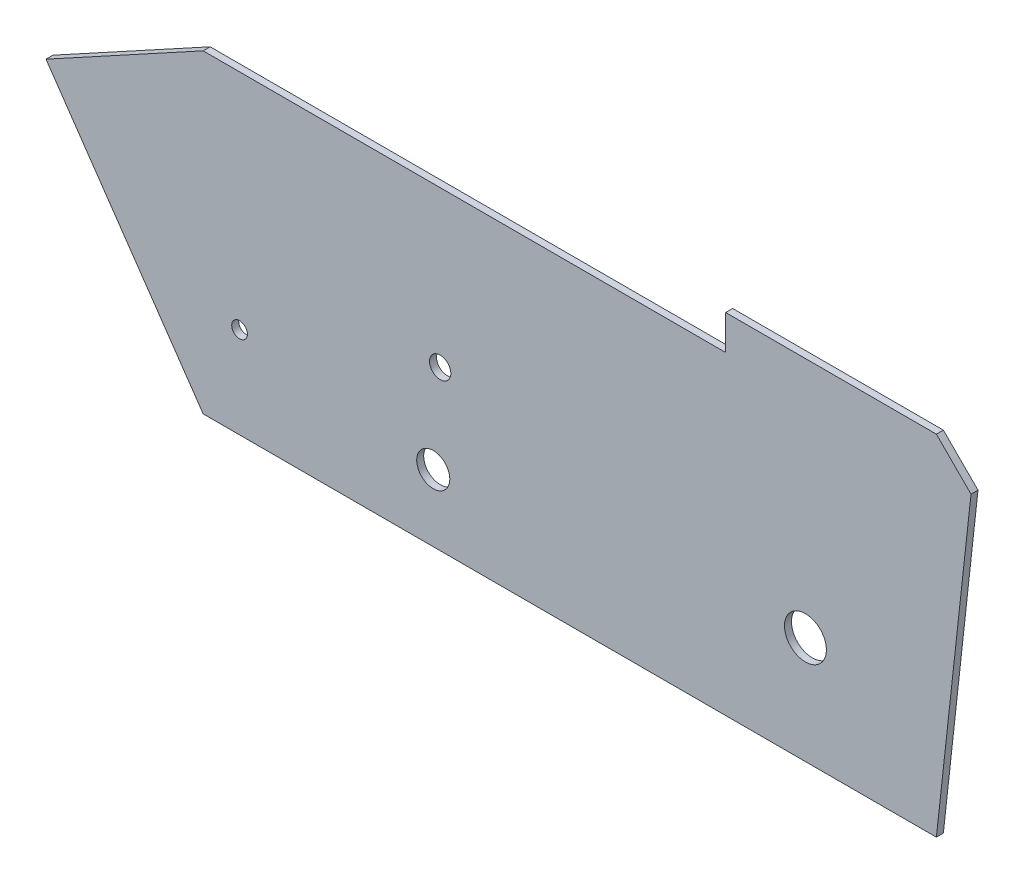
from build123d import *

# Parameters (mm, degrees)
BOSS_EXTRUDE1_DEPTH = 2
SKETCH2_R           = 6
CUT_EXTRUDE1_DEPTH  = 10
SKETCH3_R           = 3.05
CUT_EXTRUDE2_DEPTH  = 10
SKETCH4_R           = 2.250300441
CUT_EXTRUDE3_DEPTH  = 10
SKETCH5_R           = 4.740417633
CUT_EXTRUDE4_DEPTH  = 10


with BuildPart() as part:
    # Sketch1 → Boss-Extrude1 (new body)
    with BuildSketch(Plane.XY):
        Polygon((192.039285274, 88.983833718), (201.963048499, 79.060070494), (192.039285274, -11.016166282), (-18.008037477, -11.016166282), (-63.036951501, 54.472600305), (-18.008037477, 79.060070494), (131.67120814, 79.060070494), (131.67120814, 88.983833718), align=None)
    extrude(amount=BOSS_EXTRUDE1_DEPTH)

    # Sketch2 → Cut-Extrude1 (cut)
    with BuildSketch(Plane.XY.offset(2)):
        with Locations((154.523318399, 19.695137593)):
            Circle(SKETCH2_R)
    extrude(amount=-CUT_EXTRUDE1_DEPTH, mode=Mode.SUBTRACT)

    # Sketch3 → Cut-Extrude2 (cut)
    with BuildSketch(Plane.XY.offset(2)):
        with Locations((49.886677935, 34.46755227)):
            Circle(SKETCH3_R)
    extrude(amount=-CUT_EXTRUDE2_DEPTH, mode=Mode.SUBTRACT)

    # Sketch4 → Cut-Extrude3 (cut)
    with BuildSketch(Plane.XY.offset(2)):
        with Locations((-7.586199085, 15.078509139)):
            Circle(SKETCH4_R)
    extrude(amount=-CUT_EXTRUDE3_DEPTH, mode=Mode.SUBTRACT)

    # Sketch5 → Cut-Extrude4 (cut)
    with BuildSketch(Plane.XY.offset(2)):
        with Locations((47.903695827, 8.119584274)):
            Circle(SKETCH5_R)
    extrude(amount=-CUT_EXTRUDE4_DEPTH, mode=Mode.SUBTRACT)


solid = part.part
